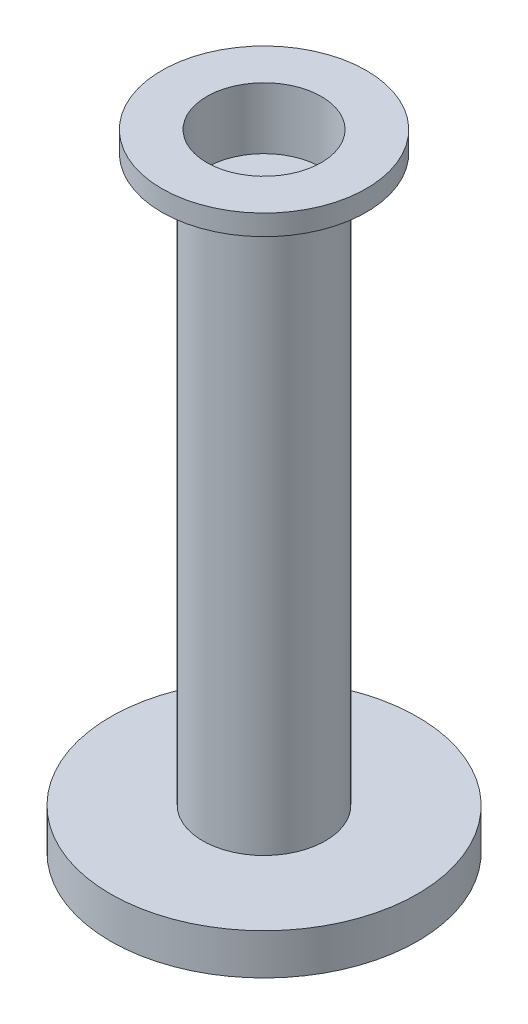
from build123d import *

# Parameters (mm, degrees)
SKETCH1_R           = 3.75
BOSS_EXTRUDE1_DEPTH = 1
SKETCH2_R           = 1.5
BOSS_EXTRUDE2_DEPTH = 13.8
SKETCH3_R           = 2.5
BOSS_EXTRUDE3_DEPTH = 0.5
SKETCH4_R           = 1.4
CUT_EXTRUDE2_DEPTH  = 1.5


with BuildPart() as part:
    # Sketch1 → Boss-Extrude1 (new body)
    with BuildSketch(Plane(origin=(0, 0, 0), x_dir=(1, 0, 0), z_dir=(0, 1, 0))):
        Circle(SKETCH1_R)
    extrude(amount=BOSS_EXTRUDE1_DEPTH)

    # Sketch2 → Boss-Extrude2 (add)
    with BuildSketch(Plane(origin=(0, 1, 0), x_dir=(1, 0, 0), z_dir=(0, 1, 0))):
        Circle(SKETCH2_R)
    extrude(amount=BOSS_EXTRUDE2_DEPTH)

    # Sketch3 → Boss-Extrude3 (add)
    with BuildSketch(Plane(origin=(0, 14.8, 0), x_dir=(1, 0, 0), z_dir=(0, 1, 0))):
        Circle(SKETCH3_R)
    extrude(amount=BOSS_EXTRUDE3_DEPTH)

    # Sketch4 → Cut-Extrude2 (cut)
    with BuildSketch(Plane(origin=(0, 15.3, 0), x_dir=(1, 0, 0), z_dir=(0, 1, 0))):
        Circle(SKETCH4_R)
    extrude(amount=-CUT_EXTRUDE2_DEPTH, mode=Mode.SUBTRACT)


solid = part.part
